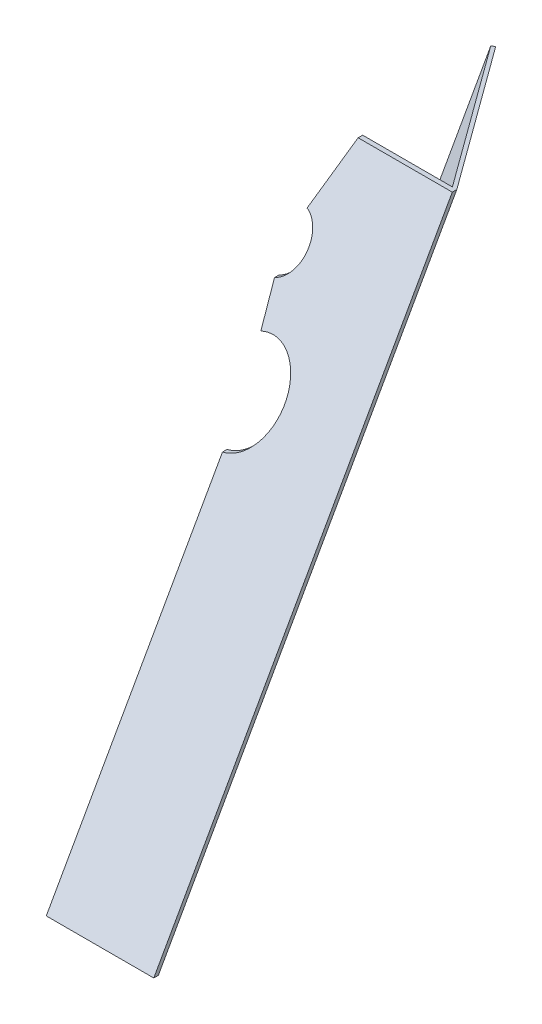
from build123d import *

# Parameters (mm, degrees)
BOSS_EXTRUDE1_DEPTH     = 2.54
SKETCH3_W               = 635
SKETCH3_H               = 1270
BOSS_EXTRUDE2_DEPTH     = 2.54
CUT_EXTRUDE1_DEPTH      = 1311.281906829
CUT_EXTRUDE1_DEPTH_BACK = 1311.281906829
SKETCH4_OUTSIDE_W       = 934.392
SKETCH4_OUTSIDE_H       = 1301.729


with BuildPart() as part:
    # Sketch2 → Boss-Extrude1 (new body)
    with BuildSketch(Plane(origin=(0, 0, 0), x_dir=(1, 0, 0), z_dir=(0, 1, 0))):
        with BuildLine():
            Line((-190.5, 0), (190.5, 0))
            Line((190.5, 0), (172.589792707, 64.649970609))
            ThreePointArc((172.589792707, 64.649970609), (148.320865378, 100.476994518), (107.315, 114.3))
            Line((107.315, 114.3), (-107.315, 114.3))
            ThreePointArc((-107.315, 114.3), (-148.320865378, 100.476994518), (-172.589792707, 64.649970609))
            Line((-172.589792707, 64.649970609), (-190.5, 0))
        make_face()
    extrude(amount=-BOSS_EXTRUDE1_DEPTH)

    # Sketch3 → Boss-Extrude2 (add)
    with BuildSketch(Plane(origin=(0, 0, 0), x_dir=(1, 0, 0), z_dir=(0, 0.6156614753256567, 0.7880107536067232))):
        with Locations((0, -635)):
            Rectangle(SKETCH3_W, SKETCH3_H)
    extrude(amount=-BOSS_EXTRUDE2_DEPTH)

    # Sketch4 outside → Cut-Extrude1 (cut, two sides: drawn at the far end of the back side and taken through both)
    with BuildSketch(Plane.XY.offset(-CUT_EXTRUDE1_DEPTH_BACK)):
        with Locations((0, -501.1685)):
            Rectangle(SKETCH4_OUTSIDE_W, SKETCH4_OUTSIDE_H)
        with BuildLine():
            Line((-266.7, -571.921009662), (-190.5, -571.921009662))
            Line((-190.5, -571.921009662), (-236.906583619, -241.721009662))
            Line((-236.906583619, -241.721009662), (-303.634542969, -241.721009662))
            Line((-303.634542969, -241.721009662), (-312.982021819, -276.089162217))
            ThreePointArc((-312.982021819, -276.089162217), (-304.535747178, -281.767279678), (-301.273366919, -291.407686738))
            ThreePointArc((-301.273366919, -291.407686738), (-304.313369935, -300.749981822), (-312.269080611, -306.514247899))
            Line((-312.269080611, -306.514247899), (-305.43807978, -327.663433526))
            ThreePointArc((-305.43807978, -327.663433526), (-282.683549554, -331.297936211), (-272.231221688, -351.833931384))
            ThreePointArc((-272.231221688, -351.833931384), (-278.461598351, -368.497830721), (-294.096224924, -376.98674033))
            Line((-294.096224924, -376.98674033), (-266.7, -571.921009662))
        make_face(mode=Mode.SUBTRACT)
    extrude(amount=CUT_EXTRUDE1_DEPTH + CUT_EXTRUDE1_DEPTH_BACK, mode=Mode.SUBTRACT)

    # Sweep1: sweep along a curve in space
    with BuildLine() as sweep1_path:
        Line((-236.906583619, -241.721009662, 185.629844207), (-190.5, -571.921009662, 443.61035808))
    # Sketch8 → Sweep1 (sweep)
    with BuildSketch(Plane(origin=(0, -241.721009662, 0), x_dir=(1, 0, 0), z_dir=(0, 1, 0))):
        Polygon((-236.906583619, -185.629844207), (-310.929097821, -84.029844207), (-312.982021819, -85.525539048), (-240.049223095, -185.629844207), align=None)
    sweep(path=sweep1_path.line)


solid = part.part
